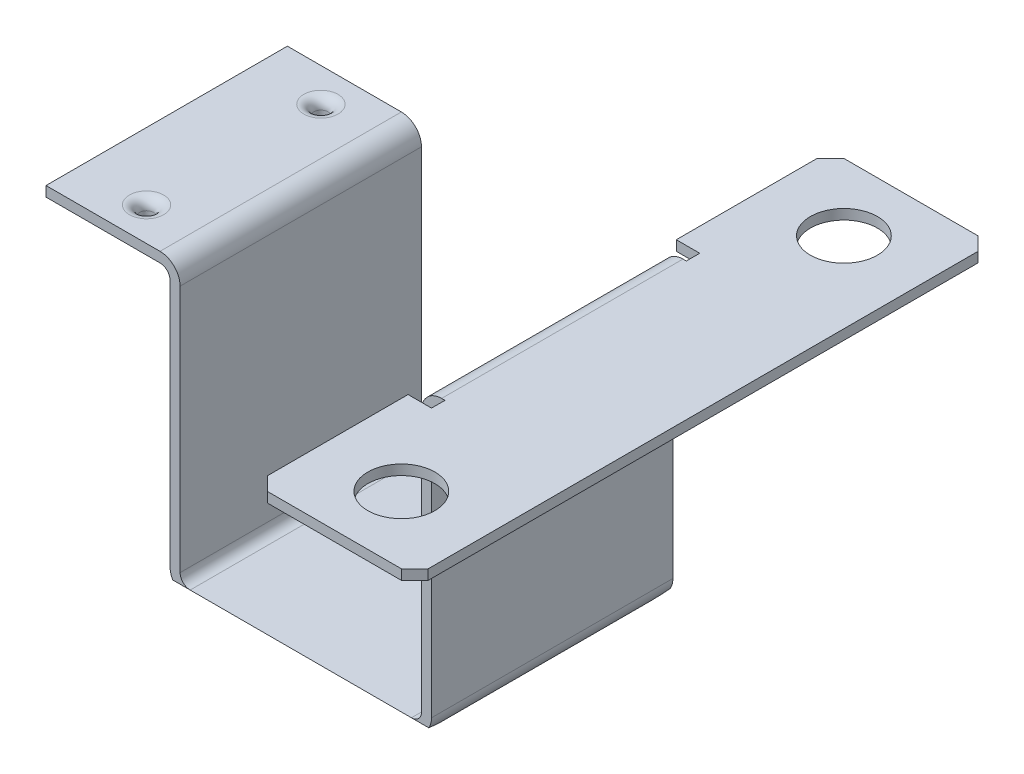
from build123d import *

# Parameters (mm, degrees)
EXTRUDE_1_DEPTH     = 36
SKETCH_2_R          = 1.05
CUT_EXTRUDE_1_DEPTH = 35
FILLET_1_R          = 1.5
FILLET_2_R          = 3
CUT_EXTRUDE_5_DEPTH = 50
SKETCH_5_W          = 24
SKETCH_5_H          = 86
SKETCH_5_R          = 5
EXTRUDE_2_DEPTH     = 1.5
SKETCH_6_W          = 2
SKETCH_6_H          = 6.336440046
CUT_EXTRUDE_6_DEPTH = 3.5
FILLET_3_R          = 1.5
FILLET_4_R          = 3
SKETCH_7_R          = 2.5
SKETCH_7_R_2        = 1.05
EXTRUDE_3_DEPTH     = 1.5
FILLET_5_R          = 1.5
CHAMFER_1_SIZE      = 2


with BuildPart() as part:
    # Эскиз1 → Вытянуть1 (new body)
    with BuildSketch(Plane.XY):
        Polygon((-20, 41.5), (0, 41.5), (0, 0), (36, 0), (36, 43.5), (60, 43.5), (60, 42), (37.5, 42), (37.5, -1.5), (-1.5, -1.5), (-1.5, 40), (-20, 40), align=None)
    extrude(amount=EXTRUDE_1_DEPTH)

    # Эскиз2 → Вырез-Вытянуть1 (cut)
    with BuildSketch(Plane(origin=(0, 41.5, 0), x_dir=(-1, 0, 0), z_dir=(0, 1, 0))):
        with Locations(Location((10, 5, 0), (0, 0, 90))):
            Circle(SKETCH_2_R)
        with Locations(Location((10, 31, 0), (0, 0, 90))):
            Circle(SKETCH_2_R)
    extrude(amount=-CUT_EXTRUDE_1_DEPTH, mode=Mode.SUBTRACT)

    # Скругление1
    fillet_1_edges = [part.edges().sort_by_distance(p)[0] for p in [
        (0, 0, 18),
        (36, 0, 18),
        (-1.5, 40, 18),
    ]]
    fillet(fillet_1_edges, radius=FILLET_1_R)

    # Скругление2
    fillet_2_edges = [part.edges().sort_by_distance(p)[0] for p in [
        (0, 41.5, 18),
        (37.5, -1.5, 18),
        (-1.5, -1.5, 18),
    ]]
    fillet(fillet_2_edges, radius=FILLET_2_R)

    # Эскиз4 → Вырез-Вытянуть5 (cut)
    with BuildSketch(Plane.ZY.offset(1.5)):
        Polygon((36, 0), (30.401923789, -1.5), (5.598076211, -1.5), (0, 0), (0, -9.726752533), (36, -8.93099636), align=None)
    extrude(amount=-CUT_EXTRUDE_5_DEPTH, mode=Mode.SUBTRACT)

    # Эскиз5 → Вытянуть2 (add)
    with BuildSketch(Plane(origin=(0, 43.5, 0), x_dir=(-1, 0, 0), z_dir=(0, 1, 0))):
        with Locations((-48, 18)):
            Rectangle(SKETCH_5_W, SKETCH_5_H)
        with Locations(Location((-48, -15, 0), (0, 0, 90))):
            Circle(SKETCH_5_R, mode=Mode.SUBTRACT)
        with Locations(Location((-48, 51, 0), (0, 0, 270))):
            Circle(SKETCH_5_R, mode=Mode.SUBTRACT)
    extrude(amount=-EXTRUDE_2_DEPTH)

    # Эскиз6 → Вырез-Вытянуть6 (cut)
    with BuildSketch(Plane.ZY.offset(-36)):
        with Locations((37, 42.938728947)):
            Rectangle(SKETCH_6_W, SKETCH_6_H)
        with Locations((-1, 42.938728947)):
            Rectangle(SKETCH_6_W, SKETCH_6_H)
    extrude(amount=-CUT_EXTRUDE_6_DEPTH, mode=Mode.SUBTRACT)

    # Скругление3
    fillet_3_edges = [part.edges().sort_by_distance(p)[0] for p in [
        (37.5, 42, 18),
    ]]
    fillet(fillet_3_edges, radius=FILLET_3_R)

    # Скругление4
    fillet_4_edges = [part.edges().sort_by_distance(p)[0] for p in [
        (36, 43.5, 18),
    ]]
    fillet(fillet_4_edges, radius=FILLET_4_R)

    # Эскиз7 → Вытянуть3 (add)
    # profile 1 of 2: a face of its own
    with BuildSketch(Plane.XZ.offset(-40)):
        with Locations(Location((-10, 31, 0), (0, 0, 90))):
            Circle(SKETCH_7_R)
        with Locations(Location((-10, 31, 0), (0, 0, 90))):
            Circle(SKETCH_7_R_2, mode=Mode.SUBTRACT)
    # profile 2 of 2: a face of its own
    with BuildSketch(Plane.XZ.offset(-40)):
        with Locations(Location((-10, 5, 0), (0, 0, 90))):
            Circle(SKETCH_7_R)
        with Locations(Location((-10, 5, 0), (0, 0, 90))):
            Circle(SKETCH_7_R_2, mode=Mode.SUBTRACT)
    extrude(amount=EXTRUDE_3_DEPTH)

    # Скругление5
    fillet_5_edges = [part.edges().sort_by_distance(p)[0] for p in [
        (-10, 40, 28.5),
        (-10, 40, 2.5),
        (-10, 41.5, 3.95),
        (-10, 41.5, 29.95),
    ]]
    fillet(fillet_5_edges, radius=FILLET_5_R - 0.0001)  # a hair under: the kernel refuses the full size

    # Фаска1
    chamfer_1_edges = [part.edges().sort_by_distance(p)[0] for p in [
        (36, 42.75, 61),
        (36, 42.75, -25),
        (60, 42.75, -25),
        (60, 42.75, 61),
    ]]
    chamfer(chamfer_1_edges, length=CHAMFER_1_SIZE)


solid = part.part
